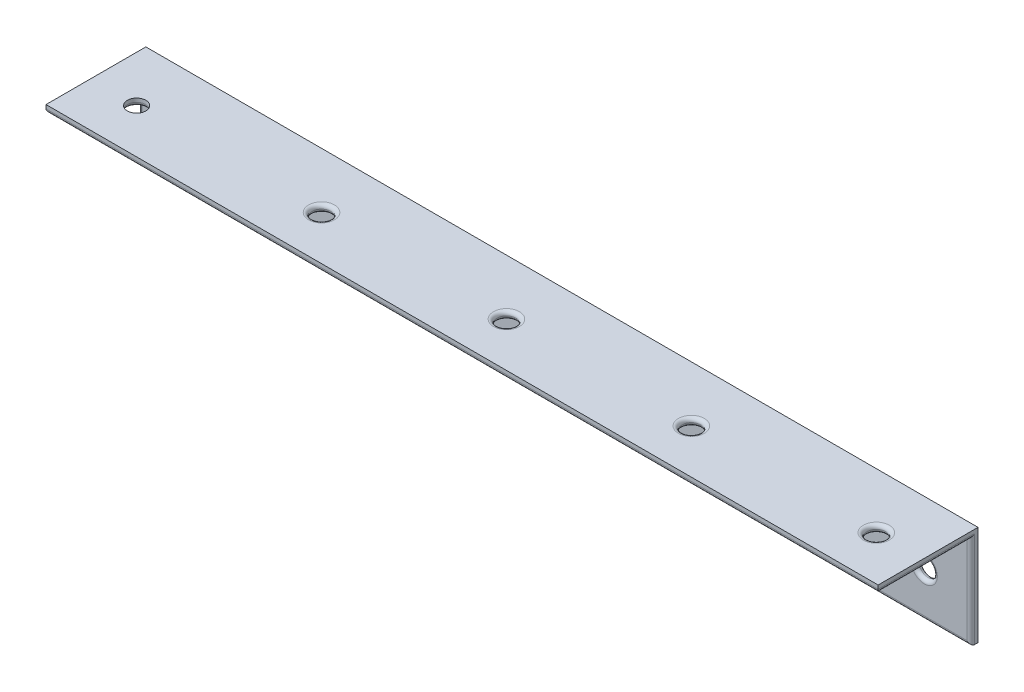
from build123d import *

# Parameters (mm, degrees)
SKETCH_1_W          = 225
SKETCH_1_H          = 27
SKETCH_1_R          = 2.5
EXTRUDE_1_DEPTH     = 1
SKETCH_2_W          = 225
SKETCH_2_H          = 2
EXTRUDE_2_DEPTH     = 25
SKETCH_3_R          = 2.5
CUT_EXTRUDE_1_DEPTH = 119.140805821
FILLET_1_R          = 1


with BuildPart() as part:
    # 草图1 → 凸台-拉伸1 (new, symmetric)
    with BuildSketch(Plane.XY):
        Rectangle(SKETCH_1_W, SKETCH_1_H)
        with Locations((-100, -1.5)):
            Circle(SKETCH_1_R, mode=Mode.SUBTRACT)
        with Locations((-50, -1.5)):
            Circle(SKETCH_1_R, mode=Mode.SUBTRACT)
        with Locations((0, -1.5)):
            Circle(SKETCH_1_R, mode=Mode.SUBTRACT)
        with Locations((50, -1.5)):
            Circle(SKETCH_1_R, mode=Mode.SUBTRACT)
        with Locations((100, -1.5)):
            Circle(SKETCH_1_R, mode=Mode.SUBTRACT)
    extrude(amount=EXTRUDE_1_DEPTH, both=True)

    # 草图2 → 凸台-拉伸2 (add)
    with BuildSketch(Plane.XY.offset(1)):
        with Locations((0, 12.5)):
            Rectangle(SKETCH_2_W, SKETCH_2_H)
    extrude(amount=EXTRUDE_2_DEPTH)

    # 草图3 → 切除-拉伸1 (cut, through all)
    with BuildSketch(Plane.XZ.offset(-11.5)):
        with Locations(Location((-100, 14, 0), (0, 0, 270))):
            Circle(SKETCH_3_R)
        with Locations(Location((-50, 14, 0), (0, 0, 270))):
            Circle(SKETCH_3_R)
        with Locations(Location((0, 14, 0), (0, 0, 270))):
            Circle(SKETCH_3_R)
        with Locations(Location((50, 14, 0), (0, 0, 270))):
            Circle(SKETCH_3_R)
        with Locations(Location((100, 14, 0), (0, 0, 270))):
            Circle(SKETCH_3_R)
    extrude(amount=-CUT_EXTRUDE_1_DEPTH, mode=Mode.SUBTRACT)

    # 圆角1
    fillet_1_edges = [part.edges().sort_by_distance(p)[0] for p in [
        (-102.5, -1.5, -1),
        (-102.5, -1.5, 1),
        (-52.5, -1.5, 1),
        (0, -13.5, 1),
        (-2.5, -1.5, -1),
        (-2.5, -1.5, 1),
        (47.5, -1.5, -1),
        (47.5, -1.5, 1),
        (97.5, -1.5, -1),
        (97.5, -1.5, 1),
        (-112.5, -1, 1),
        (-112.5, 11.5, 13.5),
        (112.5, 11.5, 13.5),
        (0, 11.5, 26),
        (112.5, -1, 1),
        (-100, 11.5, 16.5),
        (-50, 13.5, 16.5),
        (-50, 11.5, 16.5),
        (0, 13.5, 16.5),
        (0, 11.5, 16.5),
        (50, 13.5, 16.5),
        (50, 11.5, 16.5),
        (100, 13.5, 16.5),
        (100, 11.5, 16.5),
    ]]
    fillet(fillet_1_edges, radius=FILLET_1_R - 0.0001)  # a hair under: the kernel refuses the full size


solid = part.part
